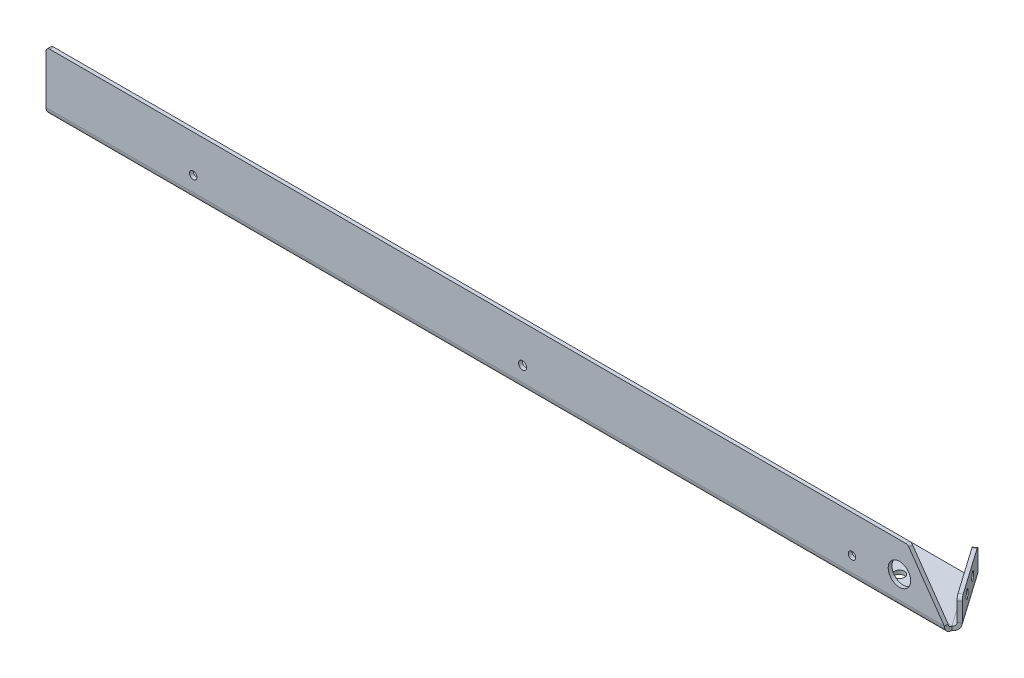
from build123d import *

# Parameters (mm, degrees)
BASE_FLANGE1_DEPTH = 762
CUT_EXTRUDE1_DEPTH = 3.175
CUT_EXTRUDE2_DEPTH = 3.175
EDGE_FLANGE1_DEPTH = 54.26343047
SKETCH9_R          = 3.175
SKETCH9_R_2        = 9.525
SKETCH9_R_3        = 3.429
CUT_EXTRUDE3_DEPTH = 3.175
SKETCH10_R         = 4.3688
SKETCH10_R_2       = 3.429
CUT_EXTRUDE4_DEPTH = 4.9022
SKETCH11_R         = 3.429
CUT_EXTRUDE5_DEPTH = 3.175
FILLET1_R          = 3.175


# Sheet-metal steps are written as plain solids
with BuildPart() as part:
    # Sketch1 → Base-Flange1 (new body)
    with BuildSketch(Plane(origin=(0, 0, 0), x_dir=(0, 0, -1), z_dir=(1, 0, 0))):
        with BuildLine():
            Line((0, 50.8), (0, 6.35))
            ThreePointArc((0, 6.35), (1.859871939, 1.859871939), (6.35, 0))
            Line((6.35, 0), (50.8, 0))
            Line((50.8, 0), (50.8, 3.175))
            Line((50.8, 3.175), (6.35, 3.175))
            ThreePointArc((6.35, 3.175), (4.10493597, 4.10493597), (3.175, 6.35))
            Line((3.175, 6.35), (3.175, 50.8))
            Line((3.175, 50.8), (0, 50.8))
        make_face()
    extrude(amount=BASE_FLANGE1_DEPTH)

    # Sketch3 → Cut-Extrude1 (cut)
    with BuildSketch(Plane(origin=(0, 0, -3.175), x_dir=(-1, 0, 0), z_dir=(0, 0, -1))):
        Polygon((-762, 6.35), (-762, 50.8), (-730.875774927, 50.8), align=None)
    extrude(amount=-CUT_EXTRUDE1_DEPTH, mode=Mode.SUBTRACT)

    # Sketch4 → Cut-Extrude2 (cut)
    with BuildSketch(Plane(origin=(0, 3.175, 0), x_dir=(1, 0, 0), z_dir=(0, 1, 0))):
        Polygon((762, 6.35), (730.875774927, 50.8), (762, 50.8), align=None)
        Polygon((0, 12.7), (54.412439057, 50.8), (0, 50.8), align=None)
    extrude(amount=-CUT_EXTRUDE2_DEPTH, mode=Mode.SUBTRACT)

    # Edge-Flange1 section (across the edge) → Edge-Flange1 (add)
    with BuildSketch(Plane(origin=(764.600807741, 3.175, -8.171105185), x_dir=(-0.8191520442889946, 3.4914813388431337e-15, 0.5735764363510422), z_dir=(-0.5735764363510422, 0, -0.8191520442889946))):
        with BuildLine():
            Line((-3.175, 3.175), (-3.175, 22.225))
            Line((-3.175, 22.225), (0, 22.225))
            Line((0, 22.225), (0, 3.175))
            ThreePointArc((0, 3.175), (0.92993597, 0.92993597), (3.175, 0))
            Line((3.175, 0), (3.175, -3.175))
            ThreePointArc((3.175, -3.175), (-1.315128061, -1.315128061), (-3.175, 3.175))
        make_face()
    extrude(amount=EDGE_FLANGE1_DEPTH)

    # Sketch9 → Cut-Extrude3 (cut)
    with BuildSketch(Plane.XY):
        with Locations((124.841, 19.05)):
            Circle(SKETCH9_R)
        with Locations((683.641, 19.05)):
            Circle(SKETCH9_R)
        with Locations((723.9, 25.4)):
            Circle(SKETCH9_R_2)
        with Locations((404.241, 19.05)):
            Circle(SKETCH9_R_3)
    extrude(amount=-CUT_EXTRUDE3_DEPTH, mode=Mode.SUBTRACT)

    # Sketch10 → Cut-Extrude4 (cut)
    with BuildSketch(Plane.XZ):
        with Locations(Location((92.075, -22.225, 0), (0, 0, 270))):
            Circle(SKETCH10_R)
        with Locations(Location((295.275, -22.225, 0), (0, 0, 270))):
            Circle(SKETCH10_R)
        with Locations(Location((498.475, -22.225, 0), (0, 0, 270))):
            Circle(SKETCH10_R)
        with Locations(Location((701.675, -22.225, 0), (0, 0, 270))):
            Circle(SKETCH10_R)
        with Locations(Location((22.225, -19.05, 0), (0, 0, 270))):
            Circle(SKETCH10_R_2)
    extrude(amount=-CUT_EXTRUDE4_DEPTH, mode=Mode.SUBTRACT)

    # Sketch11 → Cut-Extrude5 (cut)
    with BuildSketch(Plane(origin=(519.494814159, 0, -363.754184935), x_dir=(-0.5735764363510422, 1.0031284501279259e-15, -0.8191520442889946), z_dir=(0.8191520442889947, -1.4326158965565184e-15, -0.5735764363510422))):
        with Locations((-396.015198548, 15.875)):
            Circle(SKETCH11_R)
        with Locations((-415.065198548, 15.875)):
            Circle(SKETCH11_R)
    extrude(amount=-CUT_EXTRUDE5_DEPTH, mode=Mode.SUBTRACT)

    # Fillet1
    fillet1_edges = [part.edges().sort_by_distance(p)[0] for p in [
        (730.875774927, 50.8, -1.5875),
        (0, 1.5875, -12.7),
        (54.412439057, 1.5875, -50.8),
        (765.901211611, 25.4, -9.081657778),
        (734.776986538, 25.4, -53.531657778),
        (0, 50.8, -1.5875),
    ]]
    fillet(fillet1_edges, radius=FILLET1_R)


solid = part.part
